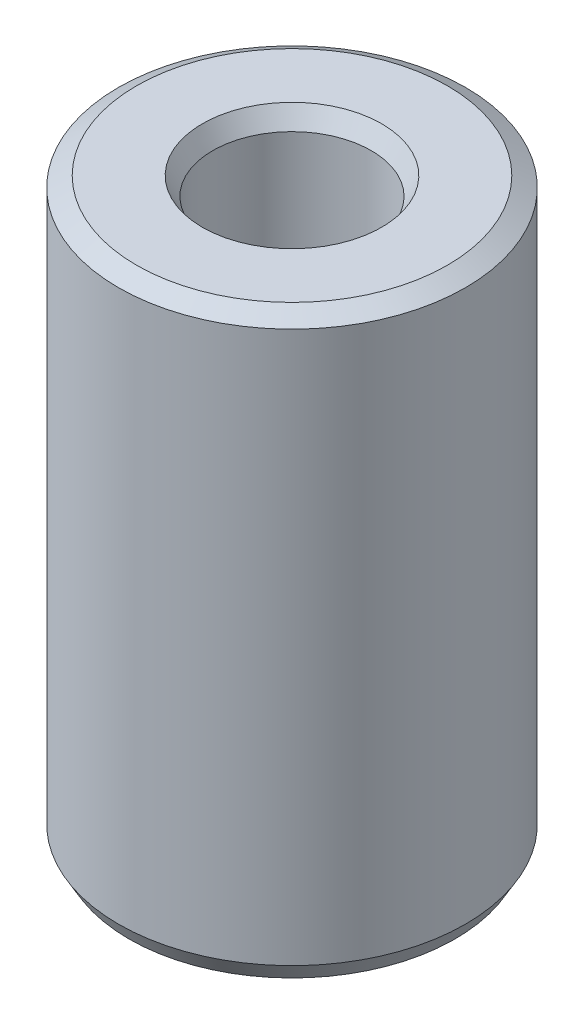
from build123d import *
from OCP.BRepFilletAPI import BRepFilletAPI_MakeChamfer

# Parameters (mm, degrees)
SKETCH1_R           = 40
BOSS_EXTRUDE1_DEPTH = 133.650748897
SKETCH2_R           = 18.27867794
CUT_EXTRUDE1_DEPTH  = 146.129330877
CHAMFER1_SIZE       = 2.401923773
CHAMFER1_SIZE2      = 4.160254011


with BuildPart() as part:
    # Sketch1 → Boss-Extrude1 (new body)
    with BuildSketch(Plane(origin=(0, 0, 0), x_dir=(1, 0, 0), z_dir=(0, 1, 0))):
        Circle(SKETCH1_R)
    extrude(amount=BOSS_EXTRUDE1_DEPTH)

    # Sketch2 → Cut-Extrude1 (cut, through all)
    with BuildSketch(Plane(origin=(0, 0, 0), x_dir=(1, 0, 0), z_dir=(0, 1, 0))):
        Circle(SKETCH2_R)
    extrude(amount=CUT_EXTRUDE1_DEPTH, mode=Mode.SUBTRACT)

    # Chamfer1: one chamfer whose edges measure the first distance from different faces: ONE call of the kernel's chamfer builder (chamfer() names one face for all edges)
    chamfer1_edges_1 = [part.edges().sort_by_distance(p)[0] for p in [
        (-18.27867794, 133.650748897, 0),
    ]]
    chamfer1_side_1 = [part.faces().sort_by_distance(p)[0] for p in [
        (-38.86862915, 133.650748897, 0),
    ]]
    chamfer1_edges_2 = [part.edges().sort_by_distance(p)[0] for p in [
        (-18.27867794, 0, 0),
    ]]
    chamfer1_side_2 = [part.faces().sort_by_distance(p)[0] for p in [
        (-18.27867794, 66.825374449, 0),
    ]]
    chamfer1_edges_3 = [part.edges().sort_by_distance(p)[0] for p in [
        (-40, 0, 0),
    ]]
    chamfer1_side_3 = [part.faces().sort_by_distance(p)[0] for p in [
        (-38.86862915, 0, 0),
    ]]
    chamfer1_edges_4 = [part.edges().sort_by_distance(p)[0] for p in [
        (-40, 133.650748897, 0),
    ]]
    chamfer1_side_4 = [part.faces().sort_by_distance(p)[0] for p in [
        (-40, 66.825374449, 0),
    ]]
    chamfer1 = BRepFilletAPI_MakeChamfer(part.part.solid().wrapped)
    for e in chamfer1_edges_1:
        chamfer1.Add(CHAMFER1_SIZE, CHAMFER1_SIZE2, e.wrapped, chamfer1_side_1[0].wrapped)  # the first distance lies on this face
    for e in chamfer1_edges_2:
        chamfer1.Add(CHAMFER1_SIZE, CHAMFER1_SIZE2, e.wrapped, chamfer1_side_2[0].wrapped)  # the first distance lies on this face
    for e in chamfer1_edges_3:
        chamfer1.Add(CHAMFER1_SIZE, CHAMFER1_SIZE2, e.wrapped, chamfer1_side_3[0].wrapped)  # the first distance lies on this face
    for e in chamfer1_edges_4:
        chamfer1.Add(CHAMFER1_SIZE, CHAMFER1_SIZE2, e.wrapped, chamfer1_side_4[0].wrapped)  # the first distance lies on this face
    add(Compound.cast(chamfer1.Shape()), mode=Mode.REPLACE)


solid = part.part
